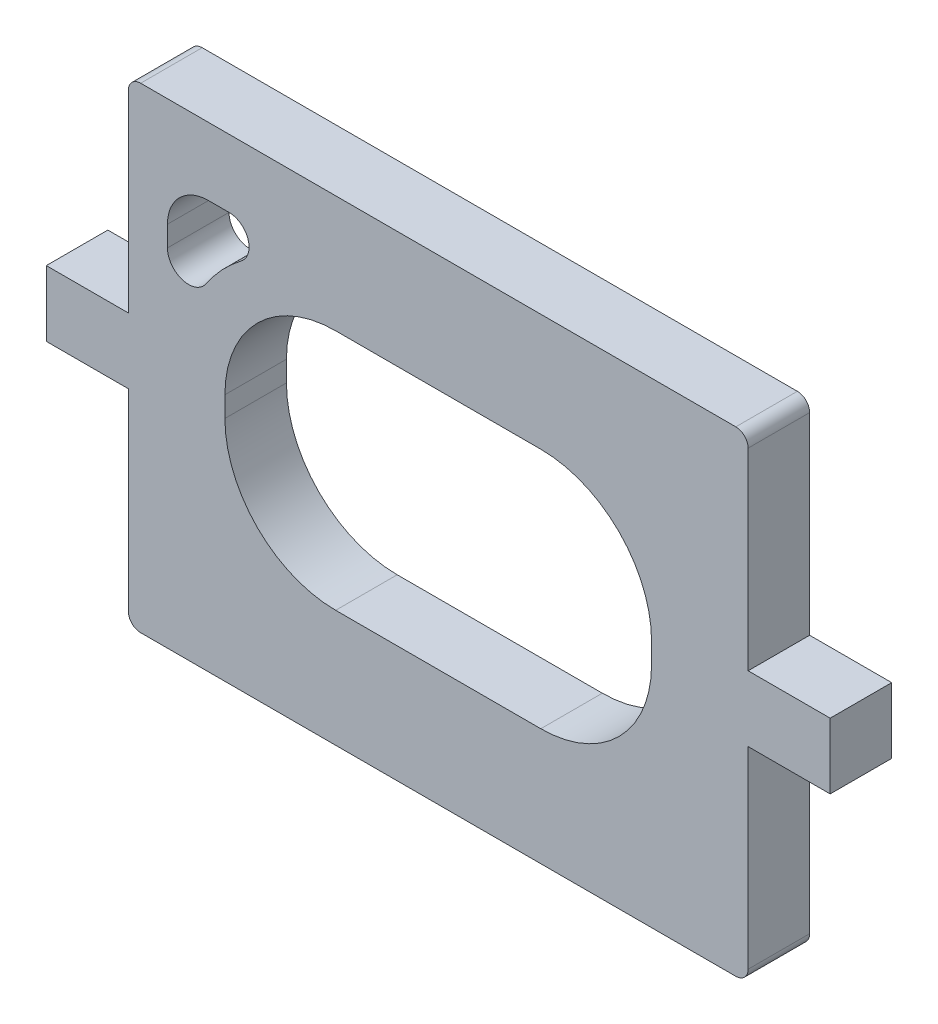
from build123d import *

# Parameters (mm, degrees)
SKETCH1_W           = 15.107508049
SKETCH1_H           = 11.6
BOSS_EXTRUDE1_DEPTH = 1.5
FILLET3_R           = 0.3
CUT_EXTRUDE2_REACH  = 38.474
SKETCH4_W           = 1.5
SKETCH4_H           = 1.6
BOSS_EXTRUDE2_DEPTH = 2
SKETCH5_W           = 1.5
SKETCH5_H           = 1.6
BOSS_EXTRUDE3_DEPTH = 2


with BuildPart() as part:
    # Sketch1 → Boss-Extrude1 (new body)
    with BuildSketch(Plane.XY):
        with Locations((27.010458398, -5.749786959)):
            Rectangle(SKETCH1_W, SKETCH1_H)
        with BuildLine():
            Line((21.810458398, -5.499786959), (21.810458398, -5.999786959))
            ThreePointArc((21.810458398, -5.999786959), (22.601270089, -7.908975268), (24.510458398, -8.699786959))
            Line((24.510458398, -8.699786959), (29.510458398, -8.699786959))
            ThreePointArc((29.510458398, -8.699786959), (31.419646707, -7.908975268), (32.210458398, -5.999786959))
            Line((32.210458398, -5.999786959), (32.210458398, -5.499786959))
            ThreePointArc((32.210458398, -5.499786959), (31.419646707, -3.59059865), (29.510458398, -2.799786959))
            Line((29.510458398, -2.799786959), (24.510458398, -2.799786959))
            ThreePointArc((24.510458398, -2.799786959), (22.601270089, -3.59059865), (21.810458398, -5.499786959))
        make_face(mode=Mode.SUBTRACT)
    extrude(amount=BOSS_EXTRUDE1_DEPTH)

    # Fillet3
    fillet3_edges = [part.edges().sort_by_distance(p)[0] for p in [
        (34.564212422, 0.050213041, 0.75),
        (19.456704373, 0.050213041, 0.75),
        (34.564212422, -11.549786959, 0.75),
        (19.456704373, -11.549786959, 0.75),
    ]]
    fillet(fillet3_edges, radius=FILLET3_R)

    # Sketch3 → Cut-Extrude2 (cut, up to next)
    with BuildSketch(Plane.XY.offset(1.5), mode=Mode.PRIVATE) as cut_extrude2_sk1:
        with BuildLine():
            Line((21.410458398, -1.599786959), (21.910458398, -1.599786959))
            ThreePointArc((21.910458398, -1.599786959), (22.373722416, -1.932321186), (22.206870207, -2.477621932))
            ThreePointArc((22.206870207, -2.477621932), (21.742228864, -2.896537979), (21.352617705, -3.386012571))
            ThreePointArc((21.352617705, -3.386012571), (20.775444134, -3.592125578), (20.410458398, -3.099786959))
            Line((20.410458398, -3.099786959), (20.410458398, -2.599786959))
            ThreePointArc((20.410458398, -2.599786959), (20.703351617, -1.892680178), (21.410458398, -1.599786959))
        make_face()
    cut_extrude2_tool1 = extrude(cut_extrude2_sk1.sketch, amount=-CUT_EXTRUDE2_REACH, mode=Mode.PRIVATE) & part.part
    add(cut_extrude2_tool1.solids().sort_by_distance((21.285663, -2.489764, 1.5))[0], mode=Mode.SUBTRACT)

    # Sketch4 → Boss-Extrude2 (add)
    with BuildSketch(Plane.ZY.offset(-19.456704373)):
        with Locations((0.75, -5.749786959)):
            Rectangle(SKETCH4_W, SKETCH4_H)
    extrude(amount=BOSS_EXTRUDE2_DEPTH)

    # Sketch5 → Boss-Extrude3 (add)
    with BuildSketch(Plane(origin=(34.564212422, 0, 0), x_dir=(0, 0, -1), z_dir=(1, 0, 0))):
        with Locations((-0.75, -5.749786959)):
            Rectangle(SKETCH5_W, SKETCH5_H)
    extrude(amount=BOSS_EXTRUDE3_DEPTH)


solid = part.part
